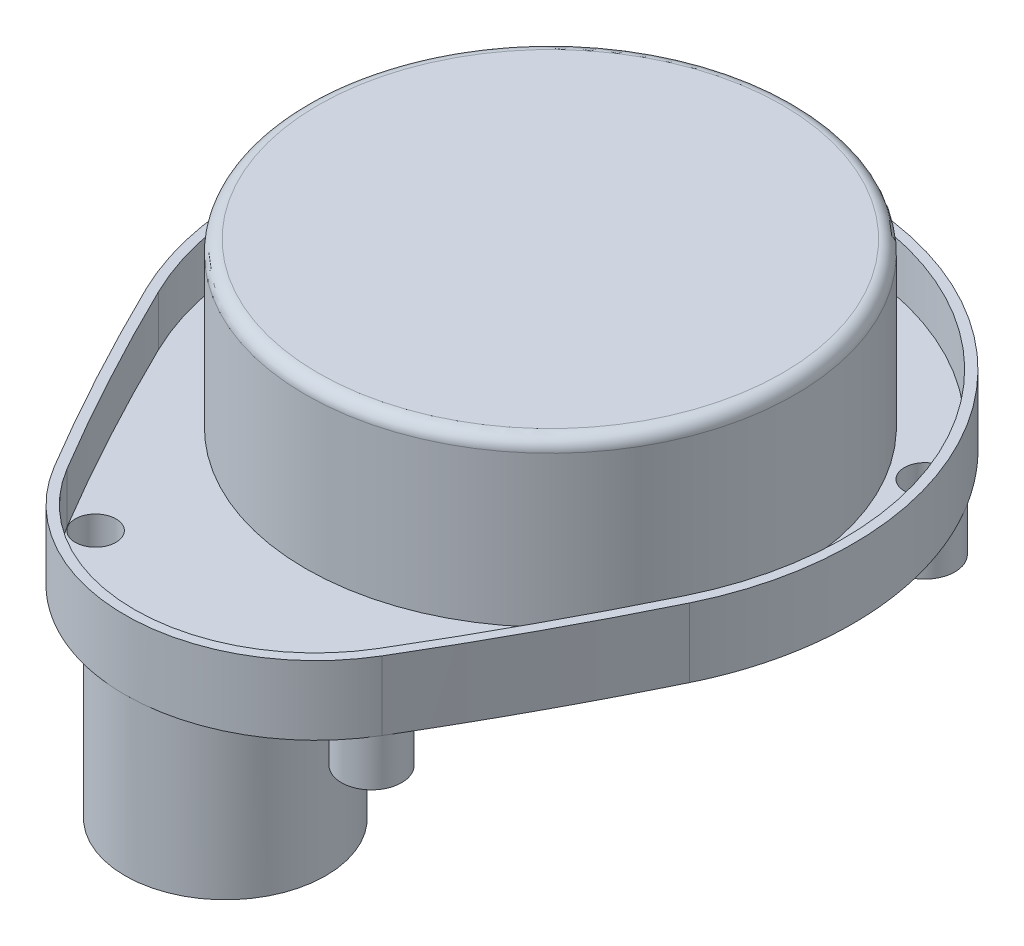
from build123d import *
from build123d.topology import SkipClean

# Parameters (mm, degrees)
BOSS_EXTRUDE2_DEPTH = 3
SKETCH3_R           = 4.8
BOSS_EXTRUDE3_DEPTH = 7.4
SKETCH6_R           = 16
BOSS_EXTRUDE6_DEPTH = 25
SKETCH4_R           = 38.5
BOSS_EXTRUDE4_DEPTH = 6
SKETCH5_R           = 28.2
BOSS_EXTRUDE5_DEPTH = 1.4
CHAMFER1_SIZE       = 1.4
FILLET2_R           = 2
SKETCH7_R           = 3.25
CUT_EXTRUDE1_DEPTH  = 2
CHAMFER2_SIZE       = 0.5
SKETCH9_R           = 1.5
CUT_EXTRUDE2_DEPTH  = 86.464847
BOSS_EXTRUDE7_DEPTH = 8
CUT_EXTRUDE3_START  = -6
SKETCH14_R          = 3.25
CUT_EXTRUDE3_DEPTH  = 6
SKETCH15_R          = 39
BOSS_EXTRUDE8_DEPTH = 26
FILLET3_R           = 2


with BuildPart() as part:
    # Sketch1 → Boss-Extrude2 (new body)
    with BuildSketch(Plane(origin=(0, 0, 0), x_dir=(1, 0, 0), z_dir=(0, 1, 0))):
        with BuildLine():
            ThreePointArc((26.12441, -52.949401), (0, -67.8), (-26.12441, -52.949401))
            ThreePointArc((-26.12441, -52.949401), (-35.050657, -37.22281), (-43.31697, -21.139539))
            ThreePointArc((-43.31697, -21.139539), (-40.878881, 25.537367), (0, 48.2))
            ThreePointArc((0, 48.2), (40.878881, 25.537367), (43.31697, -21.139539))
            ThreePointArc((43.31697, -21.139539), (35.050657, -37.22281), (26.12441, -52.949401))
        make_face()
    extrude(amount=BOSS_EXTRUDE2_DEPTH)

    # Sketch3 → Boss-Extrude3 (add)
    with BuildSketch(Plane.XZ):
        with Locations(Location((37, -22.683915, 0), (0, 0, 328.488032))):
            Circle(SKETCH3_R)
        with Locations(Location((-37, -22.683915, 0), (0, 0, 211.511188))):
            Circle(SKETCH3_R)
        with Locations(Location((-22, 50.49395, 0), (0, 0, 149.232316))):
            Circle(SKETCH3_R)
        with Locations(Location((22, 50.49395, 0), (0, 0, 30.76691))):
            Circle(SKETCH3_R)
    extrude(amount=BOSS_EXTRUDE3_DEPTH)

    # Sketch6 → Boss-Extrude6 (add)
    with BuildSketch(Plane.XZ):
        with Locations(Location((0, 51.8, 0), (0, 0, 89.999706))):
            Circle(SKETCH6_R)
    extrude(amount=BOSS_EXTRUDE6_DEPTH)

    # Sketch4 → Boss-Extrude4 (add)
    with BuildSketch(Plane.XZ):
        Circle(SKETCH4_R)
    extrude(amount=BOSS_EXTRUDE4_DEPTH)

    # Sketch5 → Boss-Extrude5 (add)
    with BuildSketch(Plane.XZ.offset(6)):
        with Locations(Location((0, 0, 0), (0, 0, 270))):
            Circle(SKETCH5_R)
    extrude(amount=BOSS_EXTRUDE5_DEPTH)

    # Chamfer1
    chamfer1_edges = [part.edges().sort_by_distance(p)[0] for p in [
        (0, -7.4, 28.2),
    ]]
    chamfer(chamfer1_edges, length=CHAMFER1_SIZE - 0.0001)  # a hair under: the kernel refuses the full size

    # Fillet2
    fillet2_edges = [part.edges().sort_by_distance(p)[0] for p in [
        (0, -6, -38.5),
    ]]
    fillet(fillet2_edges, radius=FILLET2_R)

    # Sketch7 → Cut-Extrude1 (cut)
    with BuildSketch(Plane.XZ.offset(7.4)):
        with Locations(Location((37, -22.683915, 0), (0, 0, 270))):
            Circle(SKETCH7_R)
        with Locations(Location((-37, -22.683915, 0), (0, 0, 270))):
            Circle(SKETCH7_R)
        with Locations(Location((-22, 50.49395, 0), (0, 0, 270))):
            Circle(SKETCH7_R)
        with Locations(Location((22, 50.49395, 0), (0, 0, 270))):
            Circle(SKETCH7_R)
    extrude(amount=-CUT_EXTRUDE1_DEPTH, mode=Mode.SUBTRACT)

    # Chamfer2
    chamfer2_edges = [part.edges().sort_by_distance(p)[0] for p in [
        (37, -7.4, -19.433915),
        (-37, -7.4, -19.433915),
        (-22, -7.4, 53.74395),
        (22, -7.4, 53.74395),
    ]]
    chamfer(chamfer2_edges, length=CHAMFER2_SIZE)

    # Sketch9 → Cut-Extrude2 (cut, through all)
    with BuildSketch(Plane.XZ.offset(5.4)):
        with Locations(Location((22, 50.49395, 0), (0, 0, 270))):
            Circle(SKETCH9_R)
        with Locations(Location((-22, 50.49395, 0), (0, 0, 270))):
            Circle(SKETCH9_R)
        with Locations(Location((-37, -22.683915, 0), (0, 0, 270))):
            Circle(SKETCH9_R)
        with Locations(Location((37, -22.683915, 0), (0, 0, 270))):
            Circle(SKETCH9_R)
    extrude(amount=-CUT_EXTRUDE2_DEPTH, mode=Mode.SUBTRACT)

    # Sketch10 → Boss-Extrude7 (add)
    with SkipClean():  # the faces are left unmerged after this step: merging them gives an invalid solid
        with BuildSketch(Plane(origin=(0, 3, 0), x_dir=(1, 0, 0), z_dir=(0, 1, 0))):
            with BuildLine():
                ThreePointArc((0, 48.2), (-40.878881, 25.537367), (-43.31697, -21.139539))
                ThreePointArc((-43.31697, -21.139539), (-35.050657, -37.22281), (-26.12441, -52.949401))
                ThreePointArc((-26.12441, -52.949401), (0, -67.8), (26.12441, -52.949401))
                ThreePointArc((26.12441, -52.949401), (35.050657, -37.22281), (43.31697, -21.139539))
                ThreePointArc((43.31697, -21.139539), (40.878881, 25.537367), (0, 48.2))
            make_face()
            with BuildLine():
                ThreePointArc((41.968932, -20.481669), (33.731063, -36.509597), (24.835532, -52.182073))
                ThreePointArc((24.835532, -52.182073), (0, -66.3), (-24.835532, -52.182073))
                ThreePointArc((-24.835532, -52.182073), (-33.731063, -36.509597), (-41.968932, -20.481669))
                ThreePointArc((-41.968932, -20.481669), (0, 46.7), (41.968932, -20.481669))
            make_face(mode=Mode.SUBTRACT)
        extrude(amount=BOSS_EXTRUDE7_DEPTH)

    # Sketch14 → Cut-Extrude3 (cut)
    with SkipClean():  # the faces are left unmerged after this step: merging them gives an invalid solid
        with BuildSketch(Plane(origin=(0, 3, 0), x_dir=(1, 0, 0), z_dir=(0, 1, 0)).offset(CUT_EXTRUDE3_START)):
            with Locations(Location((-37, 22.683915, 0), (0, 0, 90))):
                Circle(SKETCH14_R)
            with Locations(Location((37, 22.683915, 0), (0, 0, 90))):
                Circle(SKETCH14_R)
            with Locations(Location((22, -50.49395, 0), (0, 0, 90))):
                Circle(SKETCH14_R)
            with Locations(Location((-22, -50.49395, 0), (0, 0, 90))):
                Circle(SKETCH14_R)
        extrude(amount=CUT_EXTRUDE3_DEPTH, mode=Mode.SUBTRACT)

    # Sketch15 → Boss-Extrude8 (add)
    with SkipClean():  # the faces are left unmerged after this step: merging them gives an invalid solid
        with BuildSketch(Plane(origin=(0, 3, 0), x_dir=(1, 0, 0), z_dir=(0, 1, 0))):
            with Locations(Location((0, 0, 0), (0, 0, 90))):
                Circle(SKETCH15_R)
        extrude(amount=BOSS_EXTRUDE8_DEPTH)

    # Fillet3
    fillet3_edges = [part.edges().sort_by_distance(p)[0] for p in [
        (0, 29, 39),
    ]]
    fillet(fillet3_edges, radius=FILLET3_R)


solid = part.part
